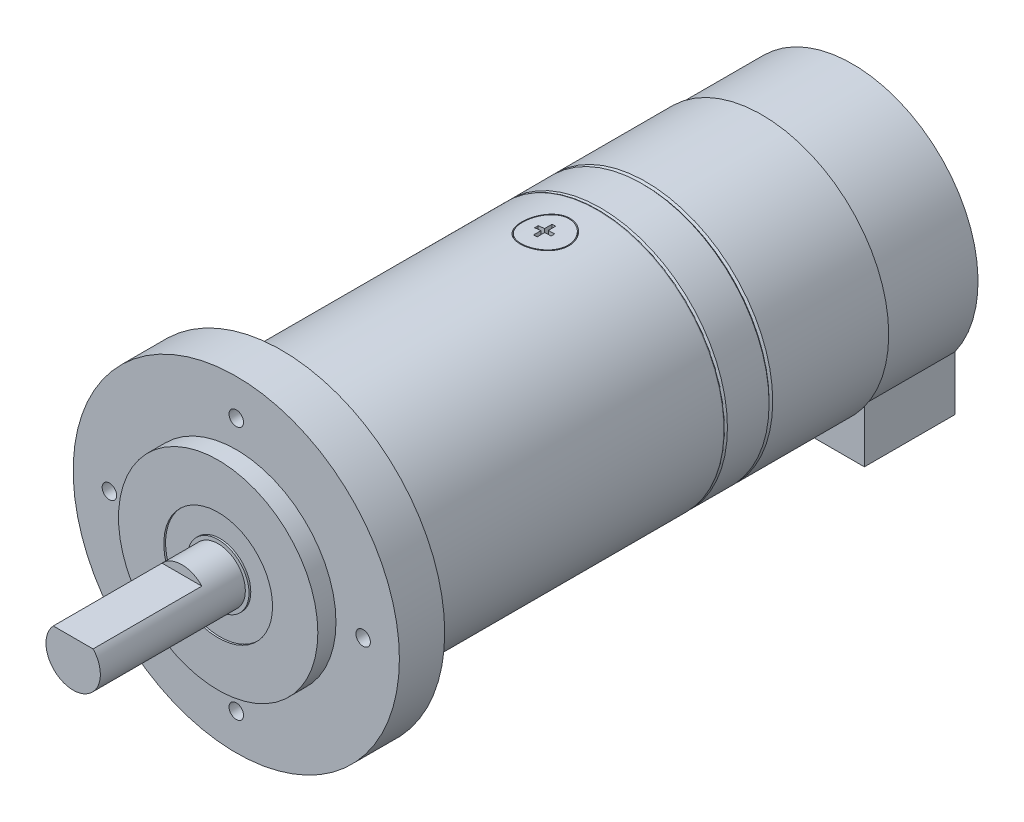
from build123d import *

# Parameters (mm, degrees)
SKETCH1_R                   = 18
BOSS_EXTRUDE2_DEPTH         = 5
SKETCH1_4_R                 = 11
BOSS_EXTRUDE3_DEPTH         = 2
SKETCH2_R                   = 3
BOSS_EXTRUDE4_DEPTH         = 16
SKETCH3_W                   = 6.362998302
SKETCH3_H                   = 1.749824533
CUT_EXTRUDE1_DEPTH          = 12
SKETCH4_R                   = 6
SKETCH4_R_2                 = 3.4
CUT_EXTRUDE2_DEPTH          = 0.2
TAP_DRILL_FOR_M2X0_4_TAP1_D = 1.6
SKETCH5_R                   = 14
BOSS_EXTRUDE5_DEPTH         = 35
FILLET2_R                   = 0.2
SKETCH7_R                   = 14
BOSS_EXTRUDE6_DEPTH         = 5
CHAMFER1_SIZE               = 0.2
SKETCH10_R                  = 14
BOSS_EXTRUDE7_DEPTH         = 13
CHAMFER2_SIZE               = 0.2
BOSS_EXTRUDE8_DEPTH         = 10
SKETCH12_R                  = 2.6
SKETCH12_R_2                = 2.5
CUT_EXTRUDE3_DEPTH          = 10.13
CUT_EXTRUDE4_DEPTH          = 2


# Some blends are built 0.0001 mm under size
with BuildPart() as part:
    # Sketch1 → Boss-Extrude2 (new body)
    with BuildSketch(Plane.XY):
        Circle(SKETCH1_R)
    extrude(amount=-BOSS_EXTRUDE2_DEPTH)

    # Sketch1<4> → Boss-Extrude3 (add)
    with BuildSketch(Plane.XY):
        Circle(SKETCH1_4_R)
    extrude(amount=BOSS_EXTRUDE3_DEPTH)

    # Sketch2 → Boss-Extrude4 (add)
    with BuildSketch(Plane.XY.offset(2)):
        Circle(SKETCH2_R)
    extrude(amount=BOSS_EXTRUDE4_DEPTH)

    # Sketch3 → Cut-Extrude1 (cut)
    with BuildSketch(Plane.XY.offset(18)):
        with Locations((0.265444357, 2.918366652)):
            Rectangle(SKETCH3_W, SKETCH3_H)
    extrude(amount=-CUT_EXTRUDE1_DEPTH, mode=Mode.SUBTRACT)

    # Sketch4 → Cut-Extrude2 (cut)
    with BuildSketch(Plane.XY.offset(2)):
        Circle(SKETCH4_R)
        Circle(SKETCH4_R_2, mode=Mode.SUBTRACT)
    extrude(amount=-CUT_EXTRUDE2_DEPTH, mode=Mode.SUBTRACT)

    # Tap Drill for M2x0.4 Tap1 (through all)
    with Locations(Plane(origin=(0, 14, -5), x_dir=(-1, 0, 0), z_dir=(0, 0, -1))):
        with Locations((0, 0), (-14, -14), (0, -28), (14, -14)):
            Hole(TAP_DRILL_FOR_M2X0_4_TAP1_D / 2)

    # Sketch5 → Boss-Extrude5 (add)
    with BuildSketch(Plane(origin=(0, 0, -5), x_dir=(-1, 0, 0), z_dir=(0, 0, -1))):
        with Locations(Location((0, 0, 0), (0, 0, 176.725509844))):
            Circle(SKETCH5_R)
    extrude(amount=BOSS_EXTRUDE5_DEPTH)

    # Fillet2
    fillet2_edges = [part.edges().sort_by_distance(p)[0] for p in [
        (-13.977142857, -0.799673403, -40),
    ]]
    fillet(fillet2_edges, radius=FILLET2_R)

    # Sketch7 → Boss-Extrude6 (add)
    with BuildSketch(Plane(origin=(0, 0, -40), x_dir=(-1, 0, 0), z_dir=(0, 0, -1))):
        with Locations(Location((0, 0, 0), (0, 0, 176.725509844))):
            Circle(SKETCH7_R)
    extrude(amount=BOSS_EXTRUDE6_DEPTH)

    # Chamfer1
    chamfer1_edges = [part.edges().sort_by_distance(p)[0] for p in [
        (-13.977142857, -0.799673403, -40),
        (-13.977142857, -0.799673403, -45),
    ]]
    chamfer(chamfer1_edges, length=CHAMFER1_SIZE - 0.0001)  # a hair under: the kernel refuses the full size

    # Sketch10 → Boss-Extrude7 (add)
    with BuildSketch(Plane(origin=(0, 0, -45), x_dir=(-1, 0, 0), z_dir=(0, 0, -1))):
        with Locations(Location((0, 0, 0), (0, 0, 176.725509844))):
            Circle(SKETCH10_R)
    extrude(amount=BOSS_EXTRUDE7_DEPTH)

    # Chamfer2
    # the kernel refuses this chamfer: 0.2 mm, written as the material it takes off along each edge
    with BuildSketch(Plane(origin=(0, 0, -45), x_dir=(0.9983673469383324, 0.057119528773576726, 0), z_dir=(-0.057119528773576726, 0.9983673469383324, 0))) as chamfer2_piece_1:
        Polygon((14, CHAMFER2_SIZE), (14 - CHAMFER2_SIZE, 0), (14, 0), align=None)
    revolve(axis=Axis((0, 0, -45), (0, 0, -1)), mode=Mode.SUBTRACT)

    # Sketch12 → Cut-Extrude3 (cut)
    with BuildSketch(Plane(origin=(0, 14, 0), x_dir=(1, 0, 0), z_dir=(0, 1, 0))):
        with Locations(Location((-0.830324238, 34.935733276, 0), (0, 0, 270))):
            Circle(SKETCH12_R)
        with Locations(Location((-0.830324238, 34.935733276, 0), (0, 0, 270))):
            Circle(SKETCH12_R_2, mode=Mode.SUBTRACT)
    extrude(amount=-CUT_EXTRUDE3_DEPTH, mode=Mode.SUBTRACT)

    # Sketch13 → Cut-Extrude4 (cut)
    with BuildSketch(Plane(origin=(0, 14, 0), x_dir=(1, 0, 0), z_dir=(0, 1, 0))):
        Polygon((-0.743156629, 35.174011268), (-0.037154138, 35.174011268), (-0.037154138, 34.777385043), (-0.743156629, 34.777385043), (-0.743156629, 33.944764058), (-1.157734464, 33.944764058), (-1.157734464, 34.777385043), (-1.858828415, 34.777385043), (-1.858828415, 35.174011268), (-1.157734464, 35.174011268), (-1.157734464, 35.994600549), (-0.743156629, 35.994600549), align=None)
    extrude(amount=-CUT_EXTRUDE4_DEPTH, mode=Mode.SUBTRACT)


with BuildPart() as body_2:
    # Sketch11 → Boss-Extrude8 (new body)
    with BuildSketch(Plane(origin=(0, 0, -58), x_dir=(-1, 0, 0), z_dir=(0, 0, -1))):
        with BuildLine():
            Line((-11.313708499, -8), (-11.313708499, -14))
            Line((-11.313708499, -14), (11.313708499, -14))
            Line((11.313708499, -14), (11.313708499, -8))
            ThreePointArc((11.313708499, -8), (0, 13.856406461), (-11.313708499, -8))
        make_face()
    extrude(amount=BOSS_EXTRUDE8_DEPTH)


solid = Compound([part.part, body_2.part])
